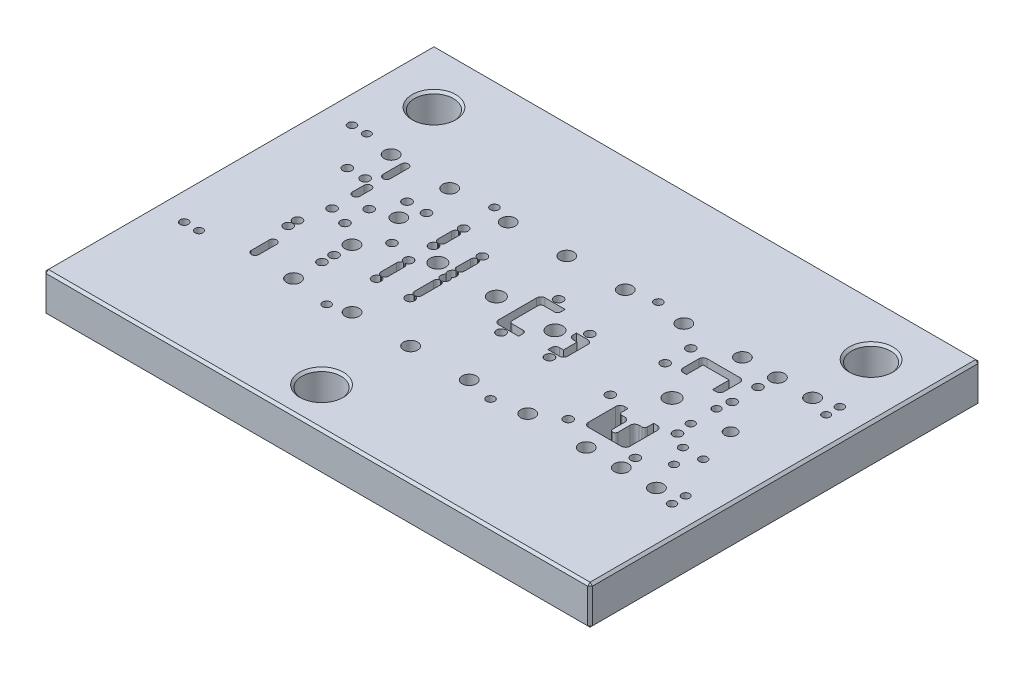
from build123d import *

# Parameters (mm, degrees)
SKETCH1_W                                            = 700
SKETCH1_H                                            = 500
BOSS_EXTRUDE1_DEPTH                                  = 50
CUT_EXTRUDE1_REACH                                   = 435.013
SKETCH2_R                                            = 25
CHAMFER1_SIZE                                        = 3
CHAMFER2_SIZE                                        = 3
CUT_EXTRUDE2_REACH                                   = 435.013
SKETCH3_R                                            = 5.113641914
SKETCH3_R_2                                          = 7.613641914
SKETCH4_R                                            = 9
SKETCH4_R_2                                          = 10
CUT_EXTRUDE3_DEPTH                                   = 23
F_11_5_11_5_DIAMETER_HOLE1_D                         = 11.5
CBORE_FOR_M10_HEX_SOCKET_HEAD_CAP_SCREW1_D           = 10.5
CBORE_FOR_M10_HEX_SOCKET_HEAD_CAP_SCREW1_CBORE_D     = 18
CBORE_FOR_M10_HEX_SOCKET_HEAD_CAP_SCREW1_CBORE_DEPTH = 10.6
F_10_0MM_DOWEL_HOLE1_D                               = 10


with BuildPart() as part:
    # Sketch1 → Boss-Extrude1 (new body)
    with BuildSketch(Plane(origin=(0, 0, 0), x_dir=(1, 0, 0), z_dir=(0, 1, 0))):
        Rectangle(SKETCH1_W, SKETCH1_H)
    extrude(amount=-BOSS_EXTRUDE1_DEPTH)

    # Sketch2 → Cut-Extrude1 (cut, up to next)
    with BuildSketch(Plane(origin=(0, 0, 0), x_dir=(1, 0, 0), z_dir=(0, 1, 0)), mode=Mode.PRIVATE) as cut_extrude1_sk1:
        with Locations((-280, 180)):
            Circle(SKETCH2_R)
    cut_extrude1_tool1 = extrude(cut_extrude1_sk1.sketch, amount=-CUT_EXTRUDE1_REACH, mode=Mode.PRIVATE) & part.part
    # Sketch2 → Cut-Extrude1 (cut, up to next)
    with BuildSketch(Plane(origin=(0, 0, 0), x_dir=(1, 0, 0), z_dir=(0, 1, 0)), mode=Mode.PRIVATE) as cut_extrude1_sk2:
        with Locations((280, 180)):
            Circle(SKETCH2_R)
    cut_extrude1_tool2 = extrude(cut_extrude1_sk2.sketch, amount=-CUT_EXTRUDE1_REACH, mode=Mode.PRIVATE) & part.part
    # Sketch2 → Cut-Extrude1 (cut, up to next)
    with BuildSketch(Plane(origin=(0, 0, 0), x_dir=(1, 0, 0), z_dir=(0, 1, 0)), mode=Mode.PRIVATE) as cut_extrude1_sk3:
        with Locations((-44, -200)):
            Circle(SKETCH2_R)
    cut_extrude1_tool3 = extrude(cut_extrude1_sk3.sketch, amount=-CUT_EXTRUDE1_REACH, mode=Mode.PRIVATE) & part.part
    add(cut_extrude1_tool1.solids().sort_by_distance((-280, 0, -180))[0], mode=Mode.SUBTRACT)
    add(cut_extrude1_tool2.solids().sort_by_distance((280, 0, -180))[0], mode=Mode.SUBTRACT)
    add(cut_extrude1_tool3.solids().sort_by_distance((-44, 0, 200))[0], mode=Mode.SUBTRACT)

    # Chamfer1
    chamfer1_edges = [part.edges().sort_by_distance(p)[0] for p in [
        (255, -50, -180),
        (255, 0, -180),
        (-305, -50, -180),
        (-305, 0, -180),
        (-69, -50, 200),
        (-69, 0, 200),
    ]]
    chamfer(chamfer1_edges, length=CHAMFER1_SIZE)

    # Chamfer2
    chamfer2_edges = [part.edges().sort_by_distance(p)[0] for p in [
        (0, -50, -250),
        (0, 0, -250),
        (350, -25, -250),
        (350, -50, 0),
        (350, 0, 0),
        (350, -25, 250),
        (0, -50, 250),
        (0, 0, 250),
        (-350, -25, 250),
        (-350, -50, 0),
        (-350, -25, -250),
        (-350, 0, 0),
    ]]
    chamfer(chamfer2_edges, length=CHAMFER2_SIZE)

    # Sketch3 → Cut-Extrude2 (cut, up to next)
    with BuildSketch(Plane.XZ.offset(50), mode=Mode.PRIVATE) as cut_extrude2_sk1:
        with Locations((270.13, 62.64)):
            Circle(SKETCH3_R)
    cut_extrude2_tool1 = extrude(cut_extrude2_sk1.sketch, amount=-CUT_EXTRUDE2_REACH, mode=Mode.PRIVATE) & part.part
    # Sketch3 → Cut-Extrude2 (cut, up to next)
    with BuildSketch(Plane.XZ.offset(50), mode=Mode.PRIVATE) as cut_extrude2_sk2:
        with Locations((283.13, 38.14)):
            Circle(SKETCH3_R)
    cut_extrude2_tool2 = extrude(cut_extrude2_sk2.sketch, amount=-CUT_EXTRUDE2_REACH, mode=Mode.PRIVATE) & part.part
    # Sketch3 → Cut-Extrude2 (cut, up to next)
    with BuildSketch(Plane.XZ.offset(50), mode=Mode.PRIVATE) as cut_extrude2_sk3:
        with Locations((257.13, 38.14)):
            Circle(SKETCH3_R)
    cut_extrude2_tool3 = extrude(cut_extrude2_sk3.sketch, amount=-CUT_EXTRUDE2_REACH, mode=Mode.PRIVATE) & part.part
    # Sketch3 → Cut-Extrude2 (cut, up to next)
    with BuildSketch(Plane.XZ.offset(50), mode=Mode.PRIVATE) as cut_extrude2_sk4:
        with Locations((235.63, 6.64)):
            Circle(SKETCH3_R)
    cut_extrude2_tool4 = extrude(cut_extrude2_sk4.sketch, amount=-CUT_EXTRUDE2_REACH, mode=Mode.PRIVATE) & part.part
    # Sketch3 → Cut-Extrude2 (cut, up to next)
    with BuildSketch(Plane.XZ.offset(50), mode=Mode.PRIVATE) as cut_extrude2_sk5:
        with Locations((270.13, -9.86)):
            Circle(SKETCH3_R_2)
    cut_extrude2_tool5 = extrude(cut_extrude2_sk5.sketch, amount=-CUT_EXTRUDE2_REACH, mode=Mode.PRIVATE) & part.part
    # Sketch3 → Cut-Extrude2 (cut, up to next)
    with BuildSketch(Plane.XZ.offset(50), mode=Mode.PRIVATE) as cut_extrude2_sk6:
        with Locations((235.63, -26.36)):
            Circle(SKETCH3_R)
    cut_extrude2_tool6 = extrude(cut_extrude2_sk6.sketch, amount=-CUT_EXTRUDE2_REACH, mode=Mode.PRIVATE) & part.part
    # Sketch3 → Cut-Extrude2 (cut, up to next)
    with BuildSketch(Plane.XZ.offset(50), mode=Mode.PRIVATE) as cut_extrude2_sk7:
        with BuildLine():
            Line((178.743641914, 30.026358086), (178.743641914, 38.14))
            ThreePointArc((178.743641914, 38.14), (179.735483234, 40.534516766), (182.13, 41.526358086))
            Line((182.13, 41.526358086), (186.13, 41.526358086))
            ThreePointArc((186.13, 41.526358086), (190.099444264, 43.170555736), (191.743641914, 47.14))
            Line((191.743641914, 47.14), (191.743641914, 62.64))
            ThreePointArc((191.743641914, 62.64), (195.13, 66.026358086), (198.516358086, 62.64))
            Line((198.516358086, 62.64), (198.516358086, 47.14))
            ThreePointArc((198.516358086, 47.14), (200.160555736, 43.170555736), (204.13, 41.526358086))
            Line((204.13, 41.526358086), (208.13, 41.526358086))
            ThreePointArc((208.13, 41.526358086), (210.524516766, 40.534516766), (211.516358086, 38.14))
            Line((211.516358086, 38.14), (211.516358086, 30.026358086))
            Line((211.516358086, 30.026358086), (216.13, 30.026358086))
            ThreePointArc((216.13, 30.026358086), (220.099444264, 31.670555736), (221.743641914, 35.64))
            Line((221.743641914, 35.64), (221.743641914, 70.64))
            ThreePointArc((221.743641914, 70.64), (220.099444264, 74.609444264), (216.13, 76.253641914))
            Line((216.13, 76.253641914), (174.13, 76.253641914))
            ThreePointArc((174.13, 76.253641914), (170.160555736, 74.609444264), (168.516358086, 70.64))
            Line((168.516358086, 70.64), (168.516358086, 35.64))
            ThreePointArc((168.516358086, 35.64), (170.160555736, 31.670555736), (174.13, 30.026358086))
            Line((174.13, 30.026358086), (178.743641914, 30.026358086))
        make_face()
    cut_extrude2_tool7 = extrude(cut_extrude2_sk7.sketch, amount=-CUT_EXTRUDE2_REACH, mode=Mode.PRIVATE) & part.part
    # Sketch3 → Cut-Extrude2 (cut, up to next)
    with BuildSketch(Plane.XZ.offset(50), mode=Mode.PRIVATE) as cut_extrude2_sk8:
        with BuildLine():
            Line((216.13, -45.067653611), (211.837653611, -45.067653611))
            Line((211.837653611, -45.067653611), (211.837653611, -66.347653611))
            Line((211.837653611, -66.347653611), (178.422346389, -66.347653611))
            Line((178.422346389, -66.347653611), (178.422346389, -45.067653611))
            Line((178.422346389, -45.067653611), (174.13, -45.067653611))
            ThreePointArc((174.13, -45.067653611), (170.38774598, -46.61774598), (168.837653611, -50.36))
            Line((168.837653611, -50.36), (168.837653611, -70.64))
            ThreePointArc((168.837653611, -70.64), (170.38774598, -74.38225402), (174.13, -75.932346389))
            Line((174.13, -75.932346389), (216.13, -75.932346389))
            ThreePointArc((216.13, -75.932346389), (219.87225402, -74.38225402), (221.422346389, -70.64))
            Line((221.422346389, -70.64), (221.422346389, -50.36))
            ThreePointArc((221.422346389, -50.36), (219.87225402, -46.61774598), (216.13, -45.067653611))
        make_face()
    cut_extrude2_tool8 = extrude(cut_extrude2_sk8.sketch, amount=-CUT_EXTRUDE2_REACH, mode=Mode.PRIVATE) & part.part
    # Sketch3 → Cut-Extrude2 (cut, up to next)
    with BuildSketch(Plane.XZ.offset(50), mode=Mode.PRIVATE) as cut_extrude2_sk9:
        with BuildLine():
            Line((72.337653611, 6.347653611), (72.337653611, -11.067653611))
            Line((72.337653611, -11.067653611), (67.13, -11.067653611))
            ThreePointArc((67.13, -11.067653611), (63.38774598, -12.61774598), (61.837653611, -16.36))
            Line((61.837653611, -16.36), (61.837653611, -20.652346389))
            Line((61.837653611, -20.652346389), (76.63, -20.652346389))
            ThreePointArc((76.63, -20.652346389), (80.37225402, -19.10225402), (81.922346389, -15.36))
            Line((81.922346389, -15.36), (81.922346389, 10.64))
            ThreePointArc((81.922346389, 10.64), (80.37225402, 14.38225402), (76.63, 15.932346389))
            Line((76.63, 15.932346389), (61.837653611, 15.932346389))
            Line((61.837653611, 15.932346389), (61.837653611, 11.64))
            ThreePointArc((61.837653611, 11.64), (63.38774598, 7.89774598), (67.13, 6.347653611))
            Line((67.13, 6.347653611), (72.337653611, 6.347653611))
        make_face()
    cut_extrude2_tool9 = extrude(cut_extrude2_sk9.sketch, amount=-CUT_EXTRUDE2_REACH, mode=Mode.PRIVATE) & part.part
    # Sketch3 → Cut-Extrude2 (cut, up to next)
    with BuildSketch(Plane.XZ.offset(50), mode=Mode.PRIVATE) as cut_extrude2_sk10:
        with BuildLine():
            Line((28.422346389, 19.932346389), (2.63, 19.932346389))
            ThreePointArc((2.63, 19.932346389), (-1.11225402, 18.38225402), (-2.662346389, 14.64))
            Line((-2.662346389, 14.64), (-2.662346389, -34.36))
            ThreePointArc((-2.662346389, -34.36), (-1.11225402, -38.10225402), (2.63, -39.652346389))
            Line((2.63, -39.652346389), (28.422346389, -39.652346389))
            Line((28.422346389, -39.652346389), (28.422346389, -33.86))
            ThreePointArc((28.422346389, -33.86), (27.311593849, -31.178406151), (24.63, -30.067653611))
            Line((24.63, -30.067653611), (10.63, -30.067653611))
            ThreePointArc((10.63, -30.067653611), (8.00829299, -28.98170701), (6.922346389, -26.36))
            Line((6.922346389, -26.36), (6.922346389, 6.64))
            ThreePointArc((6.922346389, 6.64), (8.00829299, 9.26170701), (10.63, 10.347653611))
            Line((10.63, 10.347653611), (24.63, 10.347653611))
            ThreePointArc((24.63, 10.347653611), (27.311593849, 11.458406151), (28.422346389, 14.14))
            Line((28.422346389, 14.14), (28.422346389, 19.932346389))
        make_face()
    cut_extrude2_tool10 = extrude(cut_extrude2_sk10.sketch, amount=-CUT_EXTRUDE2_REACH, mode=Mode.PRIVATE) & part.part
    # Sketch3 → Cut-Extrude2 (cut, up to next)
    with BuildSketch(Plane.XZ.offset(50), mode=Mode.PRIVATE) as cut_extrude2_sk11:
        with BuildLine():
            Line((-131.232166649, 36.69), (-131.232166649, 16.59))
            ThreePointArc((-131.232166649, 16.59), (-126.37, 11.727833351), (-121.507833351, 16.59))
            Line((-121.507833351, 16.59), (-121.507833351, 36.69))
            ThreePointArc((-121.507833351, 36.69), (-126.37, 41.552166649), (-131.232166649, 36.69))
        make_face()
    cut_extrude2_tool11 = extrude(cut_extrude2_sk11.sketch, amount=-CUT_EXTRUDE2_REACH, mode=Mode.PRIVATE) & part.part
    # Sketch3 → Cut-Extrude2 (cut, up to next)
    with BuildSketch(Plane.XZ.offset(50), mode=Mode.PRIVATE) as cut_extrude2_sk12:
        with BuildLine():
            Line((-88.162346389, 36.69), (-88.162346389, 12.59))
            ThreePointArc((-88.162346389, 12.59), (-83.37, 7.797653611), (-78.577653611, 12.59))
            Line((-78.577653611, 12.59), (-78.577653611, 36.69))
            ThreePointArc((-78.577653611, 36.69), (-83.37, 41.482346389), (-88.162346389, 36.69))
        make_face()
    cut_extrude2_tool12 = extrude(cut_extrude2_sk12.sketch, amount=-CUT_EXTRUDE2_REACH, mode=Mode.PRIVATE) & part.part
    # Sketch3 → Cut-Extrude2 (cut, up to next)
    with BuildSketch(Plane.XZ.offset(50), mode=Mode.PRIVATE) as cut_extrude2_sk13:
        with BuildLine():
            Line((-131.162346389, -36.31), (-131.162346389, -53.91))
            ThreePointArc((-131.162346389, -53.91), (-126.37, -58.702346389), (-121.577653611, -53.91))
            Line((-121.577653611, -53.91), (-121.577653611, -36.31))
            ThreePointArc((-121.577653611, -36.31), (-126.37, -31.517653611), (-131.162346389, -36.31))
        make_face()
    cut_extrude2_tool13 = extrude(cut_extrude2_sk13.sketch, amount=-CUT_EXTRUDE2_REACH, mode=Mode.PRIVATE) & part.part
    # Sketch3 → Cut-Extrude2 (cut, up to next)
    with BuildSketch(Plane.XZ.offset(50), mode=Mode.PRIVATE) as cut_extrude2_sk14:
        with BuildLine():
            Line((-88.162346389, -17.31), (-88.162346389, -34.91))
            ThreePointArc((-88.162346389, -34.91), (-83.37, -39.702346389), (-78.577653611, -34.91))
            Line((-78.577653611, -34.91), (-78.577653611, -17.31))
            ThreePointArc((-78.577653611, -17.31), (-83.37, -12.517653611), (-88.162346389, -17.31))
        make_face()
    cut_extrude2_tool14 = extrude(cut_extrude2_sk14.sketch, amount=-CUT_EXTRUDE2_REACH, mode=Mode.PRIVATE) & part.part
    # Sketch3 → Cut-Extrude2 (cut, up to next)
    with BuildSketch(Plane.XZ.offset(50), mode=Mode.PRIVATE) as cut_extrude2_sk15:
        with BuildLine():
            Line((-238.162346389, -72.87), (-238.162346389, -95.77))
            ThreePointArc((-238.162346389, -95.77), (-233.37, -100.562346389), (-228.577653611, -95.77))
            Line((-228.577653611, -95.77), (-228.577653611, -72.87))
            ThreePointArc((-228.577653611, -72.87), (-233.37, -68.077653611), (-238.162346389, -72.87))
        make_face()
    cut_extrude2_tool15 = extrude(cut_extrude2_sk15.sketch, amount=-CUT_EXTRUDE2_REACH, mode=Mode.PRIVATE) & part.part
    # Sketch3 → Cut-Extrude2 (cut, up to next)
    with BuildSketch(Plane.XZ.offset(50), mode=Mode.PRIVATE) as cut_extrude2_sk16:
        with BuildLine():
            Line((-238.162346389, 95.77), (-238.162346389, 72.87))
            ThreePointArc((-238.162346389, 72.87), (-233.37, 68.077653611), (-228.577653611, 72.87))
            Line((-228.577653611, 72.87), (-228.577653611, 95.77))
            ThreePointArc((-228.577653611, 95.77), (-233.37, 100.562346389), (-238.162346389, 95.77))
        make_face()
    cut_extrude2_tool16 = extrude(cut_extrude2_sk16.sketch, amount=-CUT_EXTRUDE2_REACH, mode=Mode.PRIVATE) & part.part
    # Sketch3 → Cut-Extrude2 (cut, up to next)
    with BuildSketch(Plane.XZ.offset(50), mode=Mode.PRIVATE) as cut_extrude2_sk17:
        with BuildLine():
            Line((-228.577653611, -48.36), (-228.577653611, -33.86))
            ThreePointArc((-228.577653611, -33.86), (-233.37, -29.067653611), (-238.162346389, -33.86))
            Line((-238.162346389, -33.86), (-238.162346389, -48.36))
            ThreePointArc((-238.162346389, -48.36), (-233.37, -53.152346389), (-228.577653611, -48.36))
        make_face()
    cut_extrude2_tool17 = extrude(cut_extrude2_sk17.sketch, amount=-CUT_EXTRUDE2_REACH, mode=Mode.PRIVATE) & part.part
    add(cut_extrude2_tool1.solids().sort_by_distance((270.13, -50, 62.64))[0], mode=Mode.SUBTRACT)
    add(cut_extrude2_tool2.solids().sort_by_distance((283.13, -50, 38.14))[0], mode=Mode.SUBTRACT)
    add(cut_extrude2_tool3.solids().sort_by_distance((257.13, -50, 38.14))[0], mode=Mode.SUBTRACT)
    add(cut_extrude2_tool4.solids().sort_by_distance((235.63, -50, 6.64))[0], mode=Mode.SUBTRACT)
    add(cut_extrude2_tool5.solids().sort_by_distance((270.13, -50, -9.86))[0], mode=Mode.SUBTRACT)
    add(cut_extrude2_tool6.solids().sort_by_distance((235.63, -50, -26.36))[0], mode=Mode.SUBTRACT)
    add(cut_extrude2_tool7.solids().sort_by_distance((176.436821, -50, 30.731348))[0], mode=Mode.SUBTRACT)
    add(cut_extrude2_tool8.solids().sort_by_distance((213.983827, -50, -45.67739))[0], mode=Mode.SUBTRACT)
    add(cut_extrude2_tool9.solids().sort_by_distance((73.54007, -50, -2.36))[0], mode=Mode.SUBTRACT)
    add(cut_extrude2_tool10.solids().sort_by_distance((15.526173, -50, 19.26029))[0], mode=Mode.SUBTRACT)
    add(cut_extrude2_tool11.solids().sort_by_distance((-126.37, -50, 26.64))[0], mode=Mode.SUBTRACT)
    add(cut_extrude2_tool12.solids().sort_by_distance((-83.37, -50, 24.64))[0], mode=Mode.SUBTRACT)
    add(cut_extrude2_tool13.solids().sort_by_distance((-126.37, -50, -45.11))[0], mode=Mode.SUBTRACT)
    add(cut_extrude2_tool14.solids().sort_by_distance((-83.37, -50, -26.11))[0], mode=Mode.SUBTRACT)
    add(cut_extrude2_tool15.solids().sort_by_distance((-233.37, -50, -84.32))[0], mode=Mode.SUBTRACT)
    add(cut_extrude2_tool16.solids().sort_by_distance((-233.37, -50, 84.32))[0], mode=Mode.SUBTRACT)
    add(cut_extrude2_tool17.solids().sort_by_distance((-233.37, -50, -41.11))[0], mode=Mode.SUBTRACT)

    # Sketch4 → Cut-Extrude3 (cut)
    with BuildSketch(Plane(origin=(0, 0, 0), x_dir=(1, 0, 0), z_dir=(0, 1, 0))):
        with Locations((-29.87, -100)):
            Circle(SKETCH4_R)
        with Locations((45.13, -100)):
            Circle(SKETCH4_R)
        with Locations((120.13, -100)):
            Circle(SKETCH4_R)
        with Locations((-104.87, 9.86)):
            Circle(SKETCH4_R_2)
        with Locations((-29.87, 9.86)):
            Circle(SKETCH4_R_2)
        with Locations((45.13, 9.86)):
            Circle(SKETCH4_R_2)
        with Locations((195.13, 9.86)):
            Circle(SKETCH4_R_2)
        with Locations((-104.87, 100)):
            Circle(SKETCH4_R)
        with Locations((-29.87, 100)):
            Circle(SKETCH4_R)
        with Locations((45.13, 100)):
            Circle(SKETCH4_R)
        with Locations((120.13, 100)):
            Circle(SKETCH4_R)
        with Locations((195.13, 100)):
            Circle(SKETCH4_R)
        with Locations((240, 100)):
            Circle(SKETCH4_R)
        with Locations((285, 100)):
            Circle(SKETCH4_R)
        with Locations((195.13, -100)):
            Circle(SKETCH4_R)
        with Locations((240, -100)):
            Circle(SKETCH4_R)
        with Locations((285, -100)):
            Circle(SKETCH4_R)
        with Locations((-179.87, 100)):
            Circle(SKETCH4_R)
        with Locations((-179.87, -100)):
            Circle(SKETCH4_R)
        with Locations((-104.87, -100)):
            Circle(SKETCH4_R)
        with Locations((-254.87, 100)):
            Circle(SKETCH4_R)
        with Locations((-179.87, -25.14)):
            Circle(SKETCH4_R)
        with Locations((-179.87, 34.86)):
            Circle(SKETCH4_R)
    extrude(amount=-CUT_EXTRUDE3_DEPTH, mode=Mode.SUBTRACT)

    # Ø11.5 (11.5) Diameter Hole1 (through all)
    with Locations(Plane(origin=(0, -50, 0), x_dir=(-1, 0, 0), z_dir=(0, -1, 0))):
        with Locations((267.87, 56.92), (245.000667118, 56.92), (232.87, 2.36), (208.37, -5.64), (208.37, 25.36), (241.62, -33.14), (241.62, -45.14), (179.87, -48.14), (179.87, -63.64), (192.37, 57.86), (167.37, 57.86), (126.37, 64.36), (126.37, 25.86), (126.37, -47.14), (126.37, -6.14), (156.12, 2.36), (83.37, -47.14), (83.37, -2.14), (83.37, 6.86), (83.37, 45.36), (-12.94, -26.986173195), (-12.94, 46.706173195), (-71.5, 28.206173195), (-71.5, -23.486173195), (-152.13, -80.14), (-152.13, -26.14), (-238.13, -80.14), (-238.13, -26.14), (-152.13, 44), (-152.13, 77), (-238.13, 44), (-238.13, 77)):
            Hole(F_11_5_11_5_DIAMETER_HOLE1_D / 2)

    # CBORE for M10 Hex Socket Head Cap Screw1 (through all)
    with Locations(Plane(origin=(0, -50, 0), x_dir=(-1, 0, 0), z_dir=(0, -1, 0))):
        with Locations((-312.5, 107.5), (-80, 107.5), (-80, -107.5), (130, -107.5), (-312.5, -107.5), (130, 107.5), (312.5, 107.5), (312.5, -107.5)):
            CounterBoreHole(CBORE_FOR_M10_HEX_SOCKET_HEAD_CAP_SCREW1_D / 2, CBORE_FOR_M10_HEX_SOCKET_HEAD_CAP_SCREW1_CBORE_D / 2, CBORE_FOR_M10_HEX_SOCKET_HEAD_CAP_SCREW1_CBORE_DEPTH)

    # Ø10.0mm Dowel Hole1 (through all)
    with Locations(Plane(origin=(0, -50, 0), x_dir=(-1, 0, 0), z_dir=(0, -1, 0))):
        with Locations((-312.5, 90), (-312.5, -90), (293.5, -107.5), (293.5, 107.5)):
            Hole(F_10_0MM_DOWEL_HOLE1_D / 2)


solid = part.part
